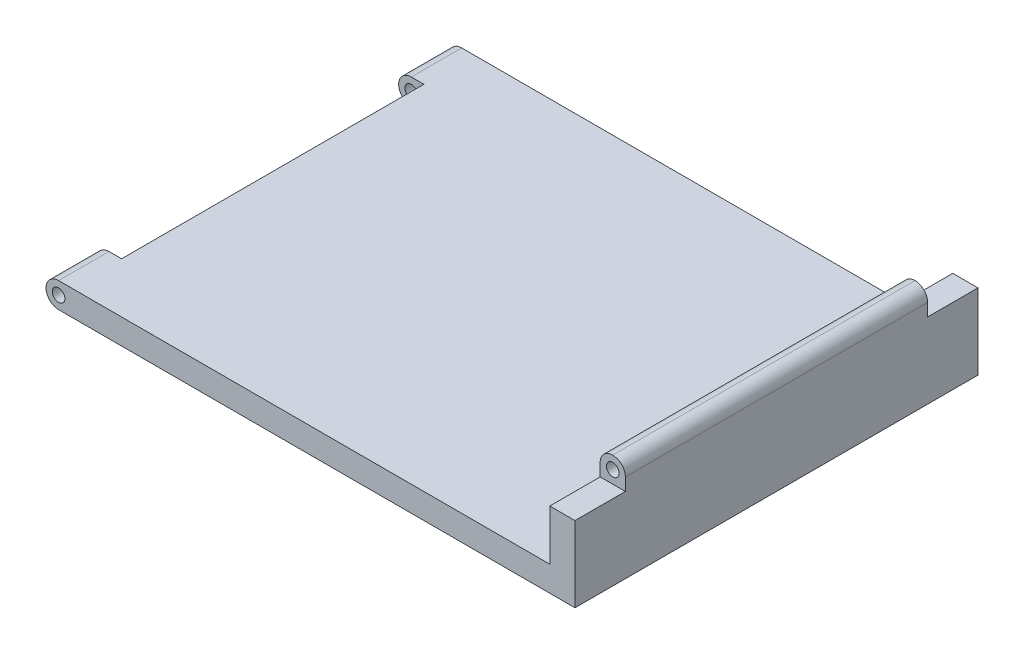
from build123d import *

# Parameters (mm, degrees)
BOSS_EXTRUDE1_DEPTH     = 40
BOSS_EXTRUDE2_START     = 30
SKETCH2_R               = 1.25
BOSS_EXTRUDE2_DEPTH     = 10
CUT_EXTRUDE1_START      = -30
SKETCH3_W               = 5
SKETCH3_H               = 5
CUT_EXTRUDE1_DEPTH      = 10
CUT_EXTRUDE2_DEPTH      = 110.544511501
CUT_EXTRUDE2_DEPTH_BACK = 110.544511501
SKETCH4_R               = 1.25
FILLET1_R               = 2.5


with BuildPart() as part:
    # Sketch1 → Boss-Extrude1 (new, symmetric)
    with BuildSketch(Plane.XY):
        Polygon((0, 0), (100, 0), (100, 20), (95, 20), (95, 5), (0, 5), align=None)
    extrude(amount=BOSS_EXTRUDE1_DEPTH, both=True)

    # Sketch2 → Boss-Extrude2 (add)
    with BuildSketch(Plane.XY.offset(BOSS_EXTRUDE2_START)):
        with BuildLine():
            Line((0, 5), (-2.5, 5))
            ThreePointArc((-2.5, 5), (-5, 2.5), (-2.5, 0))
            Line((-2.5, 0), (0, 0))
            Line((0, 0), (0, 5))
        make_face()
        with Locations((-2.5, 2.5)):
            Circle(SKETCH2_R, mode=Mode.SUBTRACT)
    boss_extrude2 = extrude(amount=BOSS_EXTRUDE2_DEPTH)

    # Mirror2: Boss-Extrude2 across plane
    add(boss_extrude2.mirror(Plane.XY))

    # Sketch3 → Cut-Extrude1 (cut)
    with BuildSketch(Plane.XY.offset(CUT_EXTRUDE1_START)):
        with Locations((97.5, 17.5)):
            Rectangle(SKETCH3_W, SKETCH3_H)
    cut_extrude1 = extrude(amount=-CUT_EXTRUDE1_DEPTH, mode=Mode.SUBTRACT)

    # Mirror3: Cut-Extrude1 across plane
    add(cut_extrude1.mirror(Plane.XY), mode=Mode.SUBTRACT)

    # Sketch4 → Cut-Extrude2 (cut, two sides: drawn at the far end of the back side and taken through both)
    with BuildSketch(Plane.XY.offset(-CUT_EXTRUDE2_DEPTH_BACK)):
        with Locations((97.5, 17.5)):
            Circle(SKETCH4_R)
    extrude(amount=CUT_EXTRUDE2_DEPTH + CUT_EXTRUDE2_DEPTH_BACK, mode=Mode.SUBTRACT)

    # Fillet1
    fillet1_edges = [part.edges().sort_by_distance(p)[0] for p in [
        (95, 20, 0),
        (100, 20, 0),
    ]]
    fillet(fillet1_edges, radius=FILLET1_R - 0.0001)  # a hair under: the kernel refuses the full size


solid = part.part
